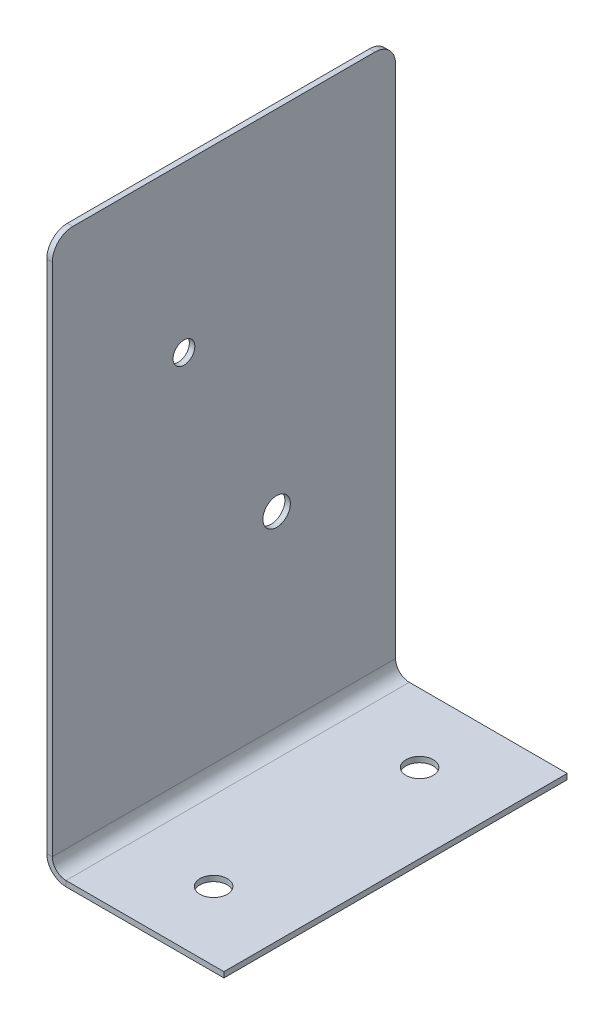
from build123d import *

# Parameters (mm, degrees)
BASE_FLANGE1_DEPTH      = 25
BASE_FLANGE1_DEPTH_BACK = 25
SKETCH6_R               = 1.5875
SKETCH6_R_2             = 2
CUT_EXTRUDE1_DEPTH      = 88.464278423
SKETCH7_R               = 1.984375
CUT_EXTRUDE2_DEPTH      = 10
FILLET1_R               = 3


# Sheet-metal steps are written as plain solids
with BuildPart() as part:
    # Sketch1 → Base-Flange1 (new, two sides: drawn at the far end of the back side and taken through both)
    with BuildSketch(Plane.XY.offset(-BASE_FLANGE1_DEPTH_BACK)):
        with BuildLine():
            Line((0, 80), (0, 2))
            ThreePointArc((0, 2), (0.585786438, 0.585786438), (2, 0))
            Line((2, 0), (25, 0))
            Line((25, 0), (25, -0.8))
            Line((25, -0.8), (2, -0.8))
            ThreePointArc((2, -0.8), (0.020101013, 0.020101013), (-0.8, 2))
            Line((-0.8, 2), (-0.8, 80))
            Line((-0.8, 80), (0, 80))
        make_face()
    extrude(amount=BASE_FLANGE1_DEPTH + BASE_FLANGE1_DEPTH_BACK)

    # Sketch6 → Cut-Extrude1 (cut, through all)
    with BuildSketch(Plane(origin=(0, 0, 0), x_dir=(0, 0, -1), z_dir=(1, 0, 0))):
        with Locations(Location((-5.824020981, 55.990856649, 0), (0, 0, 90))):
            Circle(SKETCH6_R)
        with Locations(Location((7.675979019, 29.2, 0), (0, 0, 90))):
            Circle(SKETCH6_R_2)
    extrude(amount=-CUT_EXTRUDE1_DEPTH, mode=Mode.SUBTRACT)

    # Sketch7 → Cut-Extrude2 (cut)
    with BuildSketch(Plane(origin=(0, 0, 0), x_dir=(1, 0, 0), z_dir=(0, 1, 0))):
        with Locations(Location((13.5, 15, 0), (0, 0, 270))):
            Circle(SKETCH7_R)
        with Locations(Location((13.5, -15, 0), (0, 0, 270))):
            Circle(SKETCH7_R)
    extrude(amount=-CUT_EXTRUDE2_DEPTH, mode=Mode.SUBTRACT)

    # Fillet1
    fillet1_edges = [part.edges().sort_by_distance(p)[0] for p in [
        (-0.4, 80, 25),
        (-0.4, 80, -25),
    ]]
    fillet(fillet1_edges, radius=FILLET1_R)


solid = part.part
